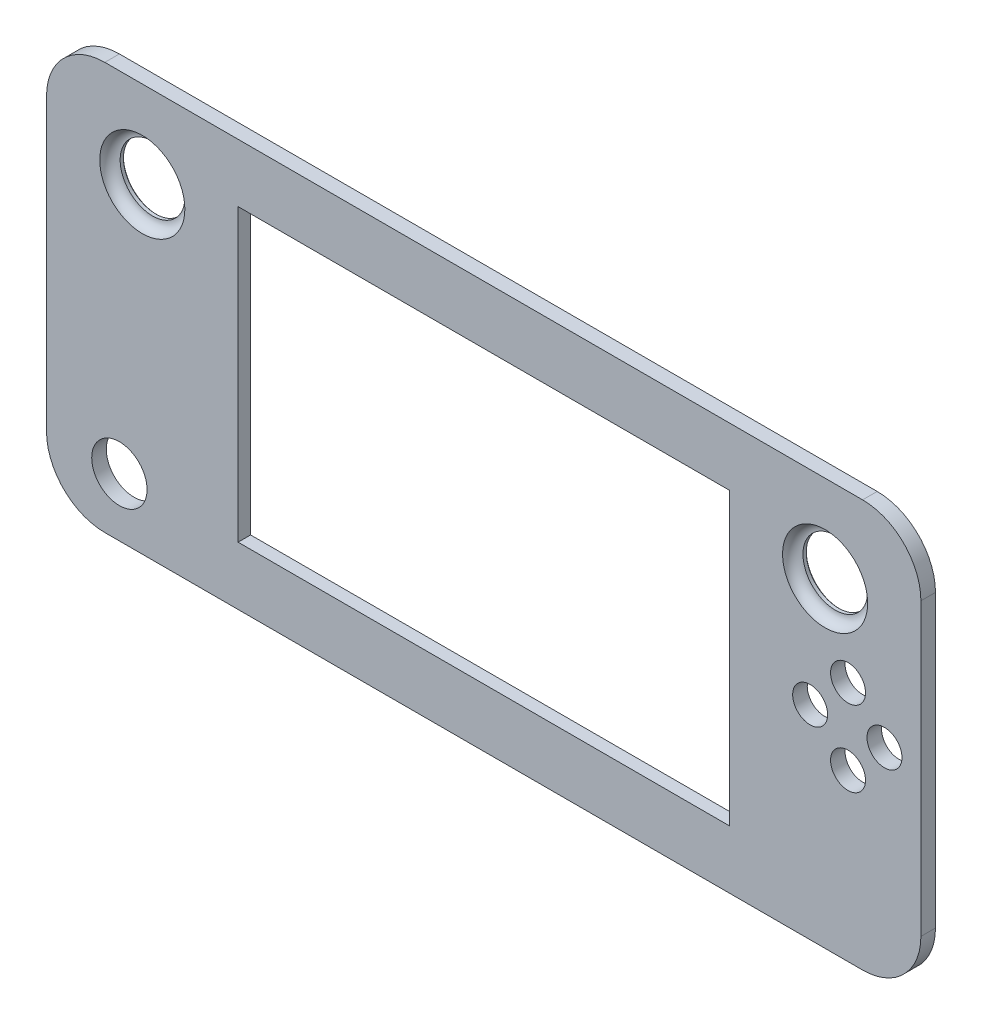
from build123d import *

# Parameters (mm, degrees)
BOSS_EXTRUDE1_DEPTH = 5
CUT_EXTRUDE1_DEPTH  = 0.7
SKETCH7_W           = 168.55
SKETCH7_H           = 99.71
CUT_EXTRUDE2_DEPTH  = 166.54571941
SKETCH8_R           = 11.1025
CUT_EXTRUDE3_DEPTH  = 166.54571941
CHAMFER1_SIZE       = 0.365
SKETCH58_R          = 6
CUT_EXTRUDE4_DEPTH  = 166.54571941
SKETCH59_R          = 9.5
CUT_EXTRUDE5_DEPTH  = 166.54571941


# Read off the part's stored shape, not the designer's step: Cut-Sweep1, Cut-Sweep2
with BuildPart() as part:
    # Sketch1 → Boss-Extrude1 (new body)
    with BuildSketch(Plane.XY):
        with BuildLine():
            Line((-130, 69.8597539), (130, 69.8597539))
            ThreePointArc((130, 69.8597539), (144.142135624, 64.001889524), (150, 49.8597539))
            Line((150, 49.8597539), (150, -49.8597539))
            ThreePointArc((150, -49.8597539), (144.142135624, -64.001889524), (130, -69.8597539))
            Line((130, -69.8597539), (-130, -69.8597539))
            ThreePointArc((-130, -69.8597539), (-144.142135624, -64.001889524), (-150, -49.8597539))
            Line((-150, -49.8597539), (-150, 49.8597539))
            ThreePointArc((-150, 49.8597539), (-144.142135624, 64.001889524), (-130, 69.8597539))
        make_face()
    extrude(amount=BOSS_EXTRUDE1_DEPTH)

    # Sketch5 → Cut-Extrude1 (cut)
    with BuildSketch(Plane.XY):
        with BuildLine():
            Line((-94.3997539, 52.3802461), (-94.3997539, -51.8597539))
            ThreePointArc((-94.3997539, -51.8597539), (-92.05660815, -57.51660815), (-86.3997539, -59.8597539))
            Line((-86.3997539, -59.8597539), (86.9202461, -59.8597539))
            ThreePointArc((86.9202461, -59.8597539), (92.577100349, -57.51660815), (94.9202461, -51.8597539))
            Line((94.9202461, -51.8597539), (94.9202461, 52.3802461))
            ThreePointArc((94.9202461, 52.3802461), (92.577100349, 58.037100349), (86.9202461, 60.3802461))
            Line((86.9202461, 60.3802461), (-86.3997539, 60.3802461))
            ThreePointArc((-86.3997539, 60.3802461), (-92.05660815, 58.037100349), (-94.3997539, 52.3802461))
        make_face()
    extrude(amount=CUT_EXTRUDE1_DEPTH, mode=Mode.SUBTRACT)

    # Sketch7 → Cut-Extrude2 (cut, through all)
    with BuildSketch(Plane.XY):
        Rectangle(SKETCH7_W, SKETCH7_H)
    extrude(amount=CUT_EXTRUDE2_DEPTH, mode=Mode.SUBTRACT)

    # Sketch8 → Cut-Extrude3 (cut, through all)
    with BuildSketch(Plane.XY.offset(5)):
        with Locations((-117.1375, 40)):
            Circle(SKETCH8_R)
        with Locations(Location((117.1375, 40, 0), (0, 0, 180))):
            Circle(SKETCH8_R)
    extrude(amount=-CUT_EXTRUDE3_DEPTH, mode=Mode.SUBTRACT)

    # Chamfer1
    chamfer1_edges = [part.edges().sort_by_distance(p)[0] for p in [
        (-128.24, 40, 0),
        (128.24, 40, 0),
    ]]
    chamfer(chamfer1_edges, length=CHAMFER1_SIZE)

    # Cut-Sweep1 outline → Cut-Sweep1 (revolve, cut)
    with BuildSketch(Plane(origin=(-117.1375, 40, 0), x_dir=(1, 0, 0), z_dir=(0, -1, 0))):
        with BuildLine():
            Line((11.1025, 5), (11.1025, 1.5))
            ThreePointArc((11.1025, 1.5), (13.577373734, 2.525126266), (14.6025, 5))
            Line((14.6025, 5), (11.1025, 5))
        make_face()
    revolve(axis=Axis((-117.1375, 40, 0), (0, 0, 1)), mode=Mode.SUBTRACT)

    # Cut-Sweep2 outline → Cut-Sweep2 (revolve, cut)
    with BuildSketch(Plane(origin=(117.1375, 40, 0), x_dir=(1, 0, 0), z_dir=(0, -1, 0))):
        with BuildLine():
            Line((11.1025, 5), (11.1025, 1.5))
            ThreePointArc((11.1025, 1.5), (13.577373734, 2.525126266), (14.6025, 5))
            Line((14.6025, 5), (11.1025, 5))
        make_face()
    revolve(axis=Axis((117.1375, 40, 0), (0, 0, 1)), mode=Mode.SUBTRACT)

    # Sketch58 → Cut-Extrude4 (cut, through all)
    with BuildSketch(Plane(origin=(0, 0, 0), x_dir=(-1, 0, 0), z_dir=(0, 0, -1))):
        with Locations((-125, 13)):
            Circle(SKETCH58_R)
        with Locations((-112, 0)):
            Circle(SKETCH58_R)
        with Locations((-125, -13)):
            Circle(SKETCH58_R)
        with Locations((-137.5, 0)):
            Circle(SKETCH58_R)
    extrude(amount=-CUT_EXTRUDE4_DEPTH, mode=Mode.SUBTRACT)

    # Sketch59 → Cut-Extrude5 (cut, through all)
    with BuildSketch(Plane(origin=(0, 0, 0), x_dir=(-1, 0, 0), z_dir=(0, 0, -1))):
        with Locations((125, -49.8597539)):
            Circle(SKETCH59_R)
    extrude(amount=-CUT_EXTRUDE5_DEPTH, mode=Mode.SUBTRACT)


solid = part.part
